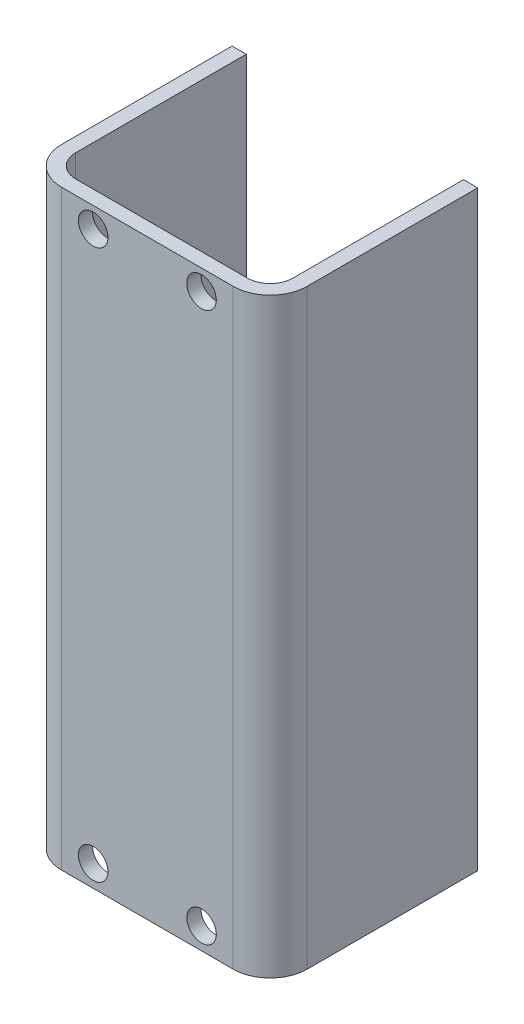
from build123d import *

# Parameters (mm, degrees)
BOSS_EXTRUDE1_DEPTH = 104
SKETCH2_R           = 2.6
CUT_EXTRUDE1_DEPTH  = 108
SKETCH3_W           = 30.2
SKETCH3_H           = 6
BOSS_EXTRUDE2_DEPTH = 2
CHAMFER1_SIZE       = 2
FILLET1_R           = 3


with BuildPart() as part:
    # Sketch1 → Boss-Extrude1 (new body)
    with BuildSketch(Plane(origin=(0, 0, 0), x_dir=(1, 0, 0), z_dir=(0, 1, 0))):
        with BuildLine():
            Line((4, 0), (34.2, 0))
            ThreePointArc((34.2, 0), (37.028427125, 1.171572875), (38.2, 4))
            Line((38.2, 4), (38.2, 34))
            Line((38.2, 34), (40.7, 34))
            Line((40.7, 34), (40.7, 4))
            ThreePointArc((40.7, 4), (38.796194078, -0.596194078), (34.2, -2.5))
            Line((34.2, -2.5), (4, -2.5))
            ThreePointArc((4, -2.5), (-0.596194078, -0.596194078), (-2.5, 4))
            Line((-2.5, 4), (-2.5, 34))
            Line((-2.5, 34), (0, 34))
            Line((0, 34), (0, 4))
            ThreePointArc((0, 4), (1.171572875, 1.171572875), (4, 0))
        make_face()
    extrude(amount=BOSS_EXTRUDE1_DEPTH)

    # Sketch2 → Cut-Extrude1 (cut)
    with BuildSketch(Plane.XY.offset(2.5)):
        with Locations((9.575, 3.81)):
            Circle(SKETCH2_R)
        with Locations((28.625, 3.81)):
            Circle(SKETCH2_R)
        with Locations((9.575, 100.41)):
            Circle(SKETCH2_R)
        with Locations((28.625, 100.41)):
            Circle(SKETCH2_R)
    extrude(amount=-CUT_EXTRUDE1_DEPTH, mode=Mode.SUBTRACT)

    # Sketch3 → Boss-Extrude2 (add)
    with BuildSketch(Plane(origin=(0, 0, 0), x_dir=(-1, 0, 0), z_dir=(0, 0, -1))):
        with Locations((-19.1, 52.595312466)):
            Rectangle(SKETCH3_W, SKETCH3_H)
    extrude(amount=BOSS_EXTRUDE2_DEPTH)

    # Chamfer1
    # the kernel refuses this chamfer: 10, 2 mm, written as the material it adds along each edge
    with BuildSketch(Plane(origin=(34.2, 55.595312466, 0), x_dir=(0.908761807760111, 0, -0.41731520072551287), z_dir=(0, -1, 0))) as chamfer1_piece_1_section:
        with BuildLine():
            Line((3.338521606, 0), (CHAMFER1_SIZE * 0.417315200726, -CHAMFER1_SIZE * 0.90876180776))
            Line((CHAMFER1_SIZE * 0.417315200726, -CHAMFER1_SIZE * 0.90876180776), (0, 0))
            ThreePointArc((0, 0), (1.841628656, 0.361237209), (3.338521606, 0))
        make_face()
    chamfer1_piece_1 = extrude(amount=6, mode=Mode.PRIVATE)
    chamfer1_piece_1 = split(chamfer1_piece_1, bisect_by=Plane(origin=(34.2, 55.595312466, -2), z_dir=(0, 0, 1)), keep=Keep.TOP, mode=Mode.PRIVATE)
    add(chamfer1_piece_1)
    with BuildSketch(Plane(origin=(4, 49.595312466, 0), x_dir=(-0.9087618077601108, 0, -0.41731520072551315), z_dir=(0, 1, 0))) as chamfer1_piece_2_section:
        with BuildLine():
            Line((3.338521606, 0), (CHAMFER1_SIZE * 0.417315200726, -CHAMFER1_SIZE * 0.90876180776))
            Line((CHAMFER1_SIZE * 0.417315200726, -CHAMFER1_SIZE * 0.90876180776), (0, 0))
            ThreePointArc((0, 0), (1.841628656, 0.361237209), (3.338521606, 0))
        make_face()
    chamfer1_piece_2 = extrude(amount=6, mode=Mode.PRIVATE)
    chamfer1_piece_2 = split(chamfer1_piece_2, bisect_by=Plane(origin=(4, 49.595312466, -2), z_dir=(0, 0, 1)), keep=Keep.TOP, mode=Mode.PRIVATE)
    add(chamfer1_piece_2)

    # Fillet1
    # the kernel refuses this fillet: 3 mm, written as the material it adds along each edge
    with BuildSketch(Plane(origin=(37.23392093, 55.595312466, -1.393215814), x_dir=(-0.9805806756909838, 0, -0.1961161351378653), z_dir=(0, -1, 0)), Plane(origin=(0.96607907, 49.595312466, -1.393215814), x_dir=(0.9805806756909838, 0, -0.19611613513786538), z_dir=(0, 1, 0))) as fillet1_piece_1:
        with BuildLine():
            CenterArc((2.674200502, 3), FILLET1_R, 168.690067526, 101.309932474)
            Line((-0.267541525, 3.588348405), (-0.561715728, 3.647183246))
            ThreePointArc((-0.561715728, 3.647183246), (-0.730260231, 2.804460732), (-0.261467751, -0.147087101))
            Line((-0.261467751, -0.147087101), (0, -0.3))
            Line((0, -0.3), (2.674200502, -0.3))
            Line((2.674200502, -0.3), (2.674200502, 0))
        make_face()
    extrude(amount=6)


solid = part.part
